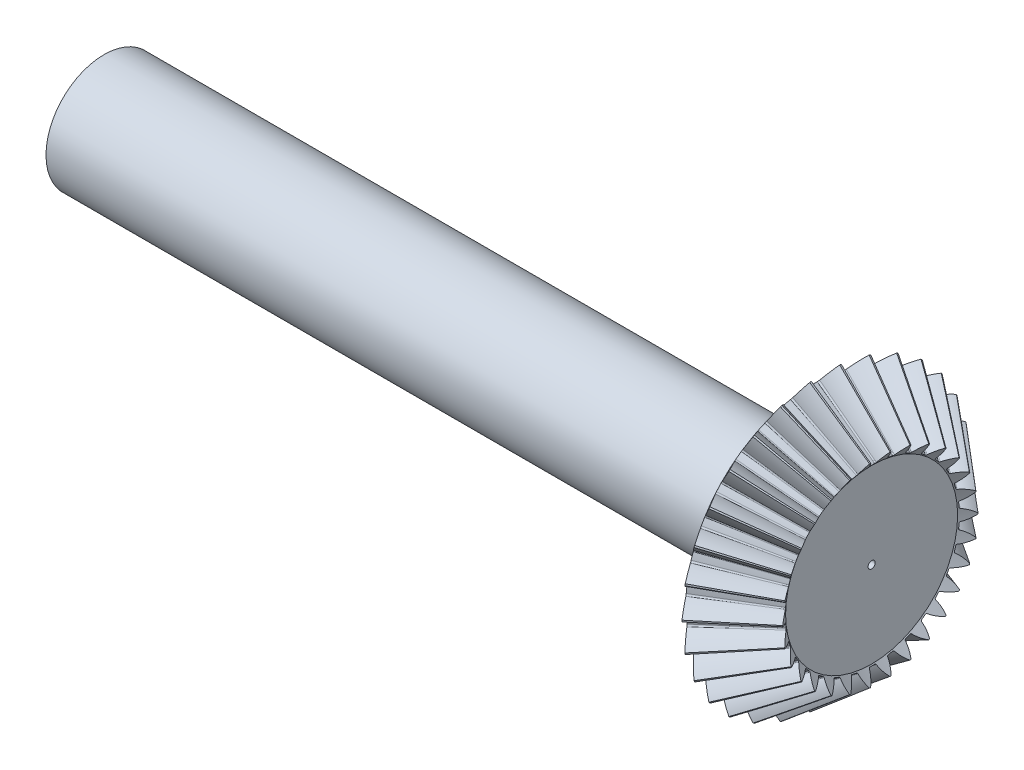
from build123d import *

# Parameters (mm, degrees)
TEETHCUTS_COUNT = 30
TEETHCUTS_ANGLE = 348
HUBSKE_R        = 6.5
HUB_DEPTH       = 79.376684933
BORSKE_R        = 0.4
BORE_DEPTH      = 100.0000508


with BuildPart() as part:
    # BasProSke → Base-Revolve (revolve)
    with BuildSketch(Plane(origin=(0, 0, 0), x_dir=(1, 0, 0), z_dir=(0, 1, 0)), mode=Mode.PRIVATE) as base_revolve_sk:
        Polygon((0, 0), (0, 14.168777778), (1.438083335, 16.086222222), (7.577389997, 10.938631106), (6.59949333, 9.634768885), (6.59949333, 0), align=None)
    revolve(base_revolve_sk.sketch.rotate(Axis((-10, 0, 0), (1, 0, 0)), 180), axis=Axis((-10, 0, 0), (1, 0, 0)))

    # ToothCut: read off the stored shape, not the designer's step
    # ToothCut: loft between two sections, ruled curve by curve
    toothcut_from = [
        Edge.make_bspline([(20.628341617, 0.006566599, -0.009690941), (20.624813025, 0.001861811, -0.01467216), (20.620214311, -0.004269808, -0.013863707), (20.617386938, -0.008039639, -0.007765111)], [0, 0, 0, 0, 1, 1, 1, 1], 3, [1, 0.794039161, 0.794039161, 1]),
        Edge.make_bspline([(20.617386938, -0.008039639, 0.007765111), (20.620214311, -0.004269808, 0.013863707), (20.624813025, 0.001861811, 0.01467216), (20.628341617, 0.006566599, 0.009690941)], [0, 0, 0, 0, 1, 1, 1, 1], 3, [1, 0.794039161, 0.794039161, 1]),
        Edge.make_bspline([(20.617386938, -0.008039639, -0.007765111), (20.617004333, -0.008549779, -0.006939838), (20.6166853, -0.008975156, -0.006042632), (20.616434651, -0.009309355, -0.005087021)], [0, 0, 0, 0, 1, 1, 1, 1], 3, [1, 0.994973925, 0.994973925, 1]),
        Edge.make_bspline([(20.616434651, -0.009309355, 0.005087021), (20.6166853, -0.008975156, 0.006042632), (20.617004333, -0.008549779, 0.006939838), (20.617386938, -0.008039639, 0.007765111)], [0, 0, 0, 0, 1, 1, 1, 1], 3, [1, 0.994973925, 0.994973925, 1]),
        Edge.make_bspline([(20.616434651, -0.009309355, -0.005087021), (20.615571419, -0.010460331, -0.001795917), (20.615571419, -0.010460331, 0.001795917), (20.616434651, -0.009309355, 0.005087021)], [0, 0, 0, 0, 1, 1, 1, 1], 3, [1, 0.944182445, 0.944182445, 1]),
        Edge.make_line((20.628341617, 0.006566599, 0.009690941), (20.628341617, 0.006566599, -0.009690941)),
    ]
    toothcut_to = [
        Edge.make_bspline([(1.57373932, 16.267096869, -1.833635763), (1.176634953, 15.737624379, -1.245767763), (0.712250273, 15.118444808, -0.816133838), (0.202874667, 14.439277334, -0.565355417)], [0, 0, 0, 0, 1, 1, 1, 1], 3, [1, 0.984000775, 0.984000775, 1]),
        Edge.make_bspline([(0.202874667, 14.439277334, 0.565355417), (0.712250273, 15.118444808, 0.816133838), (1.176634953, 15.737624379, 1.245767763), (1.57373932, 16.267096869, 1.833635763)], [0, 0, 0, 0, 1, 1, 1, 1], 3, [1, 0.984000775, 0.984000775, 1]),
        Edge.make_bspline([(0.202874667, 14.439277334, -0.565355417), (0.151625372, 14.370944941, -0.5401241), (0.120211176, 14.329059346, -0.468074319), (0.121640758, 14.330965456, -0.379042028)], [0, 0, 0, 0, 1, 1, 1, 1], 3, [1, 0.86196602, 0.86196602, 1]),
        Edge.make_bspline([(0.121640758, 14.330965456, 0.379042028), (0.120211176, 14.329059346, 0.468074319), (0.151625372, 14.370944941, 0.5401241), (0.202874667, 14.439277334, 0.565355417)], [0, 0, 0, 0, 1, 1, 1, 1], 3, [1, 0.86196602, 0.86196602, 1]),
        Edge.make_bspline([(0.121640758, 14.330965456, -0.379042028), (0.125697767, 14.336374801, -0.126377496), (0.125697767, 14.336374801, 0.126377496), (0.121640758, 14.330965456, 0.379042028)], [0, 0, 0, 0, 1, 1, 1, 1], 3, [1, 0.999761402, 0.999761402, 1]),
        Edge.make_line((1.57373932, 16.267096869, 1.833635763), (1.57373932, 16.267096869, -1.833635763)),
    ]
    toothcut = Solid(Shell([*[Face.make_surface_from_curves(toothcut_from[k], toothcut_to[k]) for k in range(6)], Face(Wire(toothcut_from)), Face(Wire(toothcut_to))]))
    add(toothcut, mode=Mode.SUBTRACT)

    # TeethCuts: ToothCut ×30 about axis
    teethcuts_axis = Axis((-10, 0, 0), (1, 0, 0))
    for i in range(1, TEETHCUTS_COUNT):
        add(toothcut.rotate(teethcuts_axis, i * TEETHCUTS_ANGLE / (TEETHCUTS_COUNT - 1)), mode=Mode.SUBTRACT)

    # HubSke → Hub (add)
    with BuildSketch(Plane.ZY):
        with Locations(Location((0, 0, 0), (0, 0, 180))):
            Circle(HUBSKE_R)
    extrude(amount=HUB_DEPTH)

    # BorSke → Bore (cut, symmetric)
    with BuildSketch(Plane(origin=(0, 0, 0), x_dir=(0, 0, -1), z_dir=(1, 0, 0))):
        with Locations(Location((0, 0, 0), (0, 0, 180))):
            Circle(BORSKE_R)
    extrude(amount=BORE_DEPTH, both=True, mode=Mode.SUBTRACT)


solid = part.part
